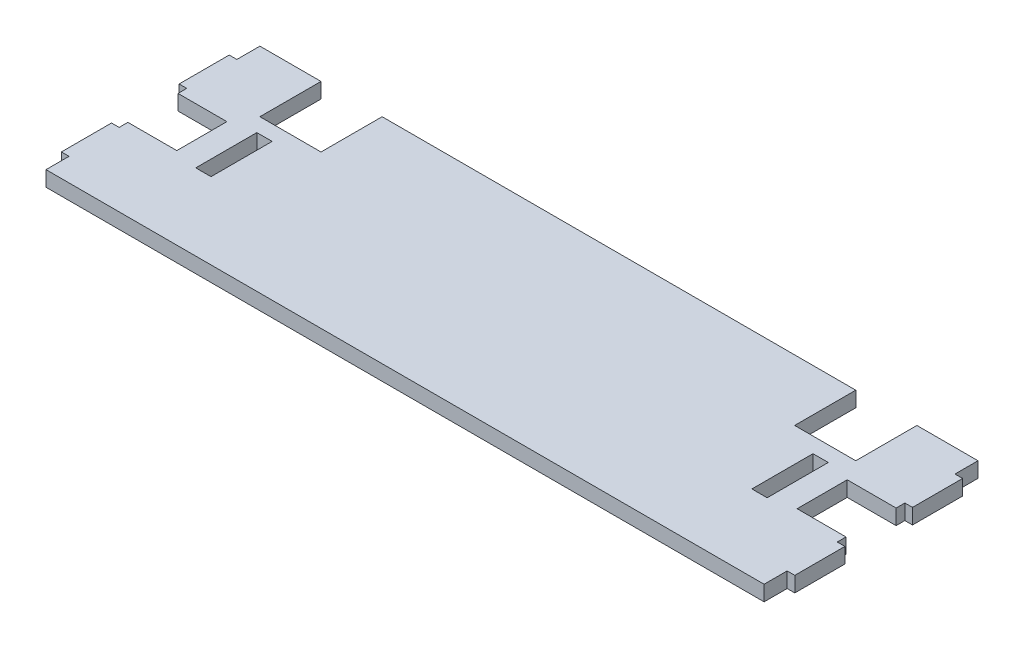
from build123d import *

# Parameters (mm, degrees)
BOSS_EXTRUDE1_DEPTH     = 3.175
CUT_EXTRUDE1_DEPTH      = 159.781746826
CUT_EXTRUDE1_DEPTH_BACK = 159.781746826
SKETCH2_W               = 6.35
SKETCH2_H               = 25.4


with BuildPart() as part:
    # Sketch1 → Boss-Extrude1 (new, symmetric)
    with BuildSketch(Plane(origin=(0, 0, 0), x_dir=(1, 0, 0), z_dir=(0, 1, 0))):
        Polygon((149.225, -44.45), (-149.225, -44.45), (-149.225, -34.874677354), (-152.4, -34.874677354), (-152.4, -14.046677354), (-149.225, -14.046677354), (-149.225, -10.414), (-128.905, -10.414), (-128.905, 10.414), (-149.225, 10.414), (-149.225, 14.046677354), (-152.4, 14.046677354), (-152.4, 34.874677354), (-149.225, 34.874677354), (-149.225, 44.45), (-123.825, 44.45), (-123.825, 19.05), (-98.425, 19.05), (-98.425, 44.45), (98.425, 44.45), (98.425, 19.05), (123.825, 19.05), (123.825, 44.45), (149.225, 44.45), (149.225, 34.874677354), (152.4, 34.874677354), (152.4, 14.046677354), (149.225, 14.046677354), (149.225, 10.414), (128.905, 10.414), (128.905, -10.414), (149.225, -10.414), (149.225, -14.046677354), (152.4, -14.046677354), (152.4, -34.874677354), (149.225, -34.874677354), align=None)
    extrude(amount=BOSS_EXTRUDE1_DEPTH, both=True)

    # Sketch2 → Cut-Extrude1 (cut, two sides: drawn at the far end of the back side and taken through both)
    with BuildSketch(Plane(origin=(0, 0, 0), x_dir=(1, 0, 0), z_dir=(0, 1, 0)).offset(-CUT_EXTRUDE1_DEPTH_BACK)):
        with Locations((115.57, 0)):
            Rectangle(SKETCH2_W, SKETCH2_H)
        with Locations((-115.57, 0)):
            Rectangle(SKETCH2_W, SKETCH2_H)
    extrude(amount=CUT_EXTRUDE1_DEPTH + CUT_EXTRUDE1_DEPTH_BACK, mode=Mode.SUBTRACT)


solid = part.part
